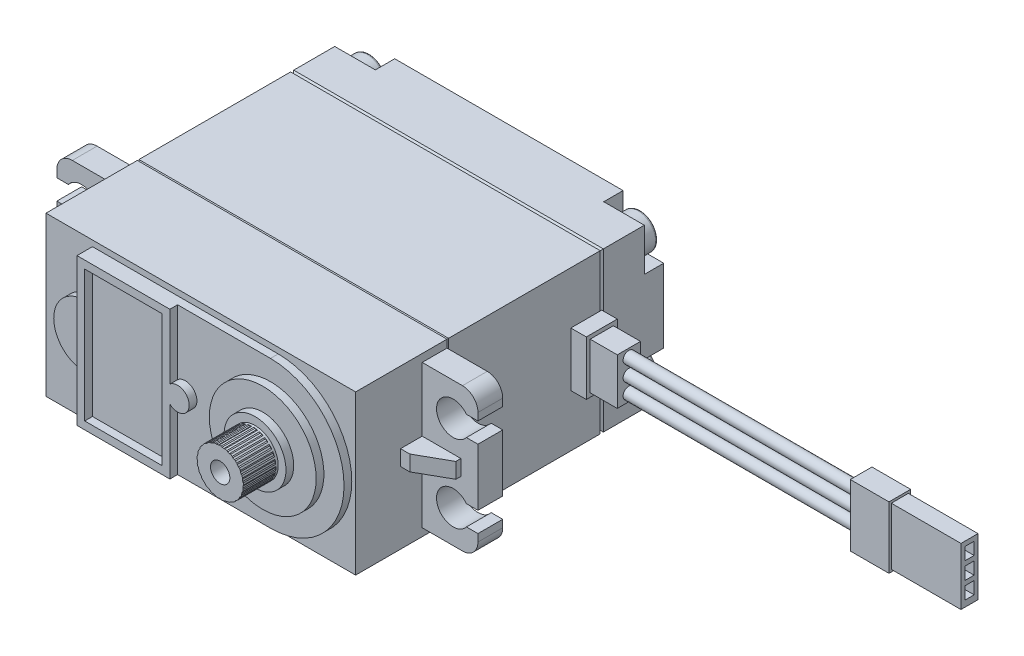
from build123d import *

# Parameters (mm, degrees)
SKETCH_1_W           = 40
SKETCH_1_H           = 20.5
EXTRUDE_1_DEPTH      = 8
CHAMFER_1_SIZE       = 0.2
SKETCH_2_W           = 40
SKETCH_2_H           = 20.5
EXTRUDE_2_DEPTH      = 20
CHAMFER_4_SIZE       = 0.2
CHAMFER_5_SIZE       = 0.2
SKETCH_3_W           = 40
SKETCH_3_H           = 20.5
EXTRUDE_3_DEPTH      = 12.8
SKETCH_4_R           = 6.9
EXTRUDE_4_DEPTH      = 2
SKETCH_5_R           = 3
EXTRUDE_5_DEPTH      = 4.5
EXTRUDE_6_DEPTH      = 3.2
SKETCH_9_W           = 5
SKETCH_9_H           = 2
EXTRUDE_7_DEPTH      = 2.8
CUT_EXTRUDE_6_DEPTH  = 2.8
SKETCH_11_R          = 1.25
CUT_EXTRUDE_7_DEPTH  = 6
CUT_EXTRUDE_START    = -4.2
CUT_EXTRUDE_8_DEPTH  = 4.2
SKETCH_13_W          = 40
SKETCH_13_H          = 20.5
CUT_EXTRUDE_9_DEPTH  = 1
FILLET_1_R           = 2
SKETCH_17_W          = 4
SKETCH_17_H          = 7
EXTRUDE_8_DEPTH      = 2
SKETCH_18_W          = 3
SKETCH_18_H          = 6
EXTRUDE_9_DEPTH      = 3.5
SKETCH_19_R          = 0.75
EXTRUDE_10_DEPTH     = 30
SKETCH_20_W          = 2.8
SKETCH_20_H          = 8
EXTRUDE_11_DEPTH     = 5
SKETCH_21_W          = 2.2
SKETCH_21_H          = 7.4
SKETCH_21_W_2        = 1.190046005
SKETCH_21_H_2        = 1.6
EXTRUDE_12_DEPTH     = 9
CUT_EXTRUDE_13_DEPTH = 2.5
SKETCH_23_R          = 2.25
EXTRUDE_13_DEPTH     = 2
FILLET_2_R           = 0.3
SKETCH_25_R          = 4
EXTRUDE_15_DEPTH     = 1
SKETCH_26_W          = 12
SKETCH_26_H          = 19
SKETCH_26_W_2        = 10
SKETCH_26_H_2        = 17
EXTRUDE_16_DEPTH     = 1
CUT_EXTRUDE_START_2  = -1
SKETCH_27_R          = 6.9
SKETCH_27_R_2        = 4
CUT_EXTRUDE_14_DEPTH = 1
SKETCH_28_R          = 1.5
EXTRUDE_17_DEPTH     = 1


with BuildPart() as part:
    # 草图1 → 凸台-拉伸1 (new body)
    with BuildSketch(Plane.XY):
        Rectangle(SKETCH_1_W, SKETCH_1_H)
    extrude(amount=EXTRUDE_1_DEPTH)

    # 倒角1
    chamfer_1_edges = [part.edges().sort_by_distance(p)[0] for p in [
        (20, 0, 8),
        (0, 10.25, 8),
        (-20, 0, 8),
        (0, -10.25, 8),
    ]]
    chamfer(chamfer_1_edges, length=CHAMFER_1_SIZE)

    # 草图2 → 凸台-拉伸2 (add)
    with BuildSketch(Plane.XY.offset(8)):
        Rectangle(SKETCH_2_W, SKETCH_2_H)
    extrude(amount=EXTRUDE_2_DEPTH)

    # 倒角4
    chamfer_4_edges = [part.edges().sort_by_distance(p)[0] for p in [
        (0, 10.25, 8),
        (-20, 0, 8),
        (0, -10.25, 8),
        (20, 0, 8),
    ]]
    chamfer(chamfer_4_edges, length=CHAMFER_4_SIZE - 0.0001)  # a hair under: the kernel refuses the full size

    # 倒角5
    chamfer_5_edges = [part.edges().sort_by_distance(p)[0] for p in [
        (0, 10.25, 28),
        (-20, 0, 28),
        (0, -10.25, 28),
        (20, 0, 28),
    ]]
    chamfer(chamfer_5_edges, length=CHAMFER_5_SIZE)

    # 草图3 → 凸台-拉伸3 (add)
    with BuildSketch(Plane.XY.offset(28)):
        Rectangle(SKETCH_3_W, SKETCH_3_H)
    extrude(amount=EXTRUDE_3_DEPTH)

    # 草图4 → 凸台-拉伸4 (add)
    with BuildSketch(Plane.XY.offset(40.8)):
        with Locations(Location((10, 0, 0), (0, 0, 180))):
            Circle(SKETCH_4_R)
    extrude(amount=EXTRUDE_4_DEPTH)

    # 草图5 → 凸台-拉伸5 (add)
    with BuildSketch(Plane.XY.offset(42.8)):
        with Locations((10, 0)):
            Circle(SKETCH_5_R)
    extrude(amount=EXTRUDE_5_DEPTH)

    # 草图8 → 凸台-拉伸6 (add)
    with BuildSketch(Plane.XY.offset(28)):
        with BuildLine():
            Line((-27.2, 9.25), (-27.2, 6.3))
            Line((-27.2, 6.3), (-25.712454379, 6.3))
            ThreePointArc((-25.712454379, 6.3), (-21.85, 5), (-25.712454379, 3.7))
            Line((-25.712454379, 3.7), (-27.2, 3.7))
            Line((-27.2, 3.7), (-27.2, -3.7))
            Line((-27.2, -3.7), (-25.712454379, -3.7))
            ThreePointArc((-25.712454379, -3.7), (-21.85, -5), (-25.712454379, -6.3))
            Line((-25.712454379, -6.3), (-27.2, -6.3))
            Line((-27.2, -6.3), (-27.2, -9.25))
            Line((-27.2, -9.25), (-20, -9.25))
            Line((-20, -9.25), (-20, 9.25))
            Line((-20, 9.25), (-27.2, 9.25))
        make_face()
        with BuildLine():
            Line((20, -9.25), (27.2, -9.25))
            Line((27.2, -9.25), (27.2, -6.3))
            Line((27.2, -6.3), (25.712454379, -6.3))
            ThreePointArc((25.712454379, -6.3), (21.85, -5), (25.712454379, -3.7))
            Line((25.712454379, -3.7), (27.2, -3.7))
            Line((27.2, -3.7), (27.2, 3.7))
            Line((27.2, 3.7), (25.712454379, 3.7))
            ThreePointArc((25.712454379, 3.7), (21.85, 5), (25.712454379, 6.3))
            Line((25.712454379, 6.3), (27.2, 6.3))
            Line((27.2, 6.3), (27.2, 9.25))
            Line((27.2, 9.25), (20, 9.25))
            Line((20, 9.25), (20, -9.25))
        make_face()
    extrude(amount=EXTRUDE_6_DEPTH)

    # 草图9 → 凸台-拉伸7 (add)
    with BuildSketch(Plane.XY.offset(31.2)):
        with Locations((-22.5, 0)):
            Rectangle(SKETCH_9_W, SKETCH_9_H)
        with Locations((22.5, 0)):
            Rectangle(SKETCH_9_W, SKETCH_9_H)
    extrude(amount=EXTRUDE_7_DEPTH)

    # 草图10 → 切除-拉伸6 (cut)
    with BuildSketch(Plane.XZ.offset(1)):
        Polygon((-25, 31.856513204), (-21.19303932, 34), (-25, 34), align=None)
        Polygon((25, 34), (25, 31.856513204), (21.19303932, 34), align=None)
    extrude(amount=-CUT_EXTRUDE_6_DEPTH, mode=Mode.SUBTRACT)

    # 草图11 → 切除-拉伸7 (cut)
    with BuildSketch(Plane.XY.offset(47.3)):
        with Locations((10, 0)):
            Circle(SKETCH_11_R)
    extrude(amount=-CUT_EXTRUDE_7_DEPTH, mode=Mode.SUBTRACT)

    # 草图12 → 切除-拉伸8 (cut)
    with BuildSketch(Plane.XY.offset(47.3).offset(CUT_EXTRUDE_START)):
        with BuildLine():
            Line((9.742545455, 2.938744146), (9.88, 2.997599039))
            ThreePointArc((9.88, 2.997599039), (9.624000299, 2.976344104), (9.370757413, 2.93326674))
            Line((9.370757413, 2.93326674), (9.518530187, 2.910444437))
            ThreePointArc((9.518530187, 2.910444437), (9.630266961, 2.926738369), (9.742545455, 2.938744146))
        make_face()
        with BuildLine():
            Line((10.257454545, 2.938744146), (10.12, 2.997599039))
            ThreePointArc((10.12, 2.997599039), (10.375999701, 2.976344104), (10.629242587, 2.93326674))
            Line((10.629242587, 2.93326674), (10.481469813, 2.910444437))
            ThreePointArc((10.481469813, 2.910444437), (10.369733039, 2.926738369), (10.257454545, 2.938744146))
        make_face()
        with BuildLine():
            Line((10.980202088, 2.782391753), (10.861702546, 2.873581167))
            ThreePointArc((10.861702546, 2.873581167), (11.104373658, 2.789329458), (11.338947549, 2.684626503))
            Line((11.338947549, 2.684626503), (11.190141652, 2.699270799))
            ThreePointArc((11.190141652, 2.699270799), (11.08596743, 2.742840633), (10.980202088, 2.782391753))
        make_face()
        with BuildLine():
            Line((11.641359928, 2.451211453), (11.549261152, 2.569005621))
            ThreePointArc((11.549261152, 2.569005621), (11.763355757, 2.427050983), (11.964521512, 2.26730131))
            Line((11.964521512, 2.26730131), (11.824032514, 2.318492051))
            ThreePointArc((11.824032514, 2.318492051), (11.733966494, 2.386600133), (11.641359928, 2.451211453))
        make_face()
        with BuildLine():
            Line((12.199385087, 1.966012523), (12.139473982, 2.103010004))
            ThreePointArc((12.139473982, 2.103010004), (12.311539728, 1.912271969), (12.466657363, 1.707513237))
            Line((12.466657363, 1.707513237), (12.343312705, 1.792033919))
            ThreePointArc((12.343312705, 1.792033919), (12.273014066, 1.88040077), (12.199385087, 1.966012523))
        make_face()
        with BuildLine():
            Line((12.619214793, 1.357281795), (12.595255794, 1.504874535))
            ThreePointArc((12.595255794, 1.504874535), (12.714481157, 1.277337875), (12.81380406, 1.040435827))
            Line((12.81380406, 1.040435827), (12.71535394, 1.152975706))
            ThreePointArc((12.71535394, 1.152975706), (12.669239805, 1.25604891), (12.619214793, 1.357281795))
        make_face()
        with BuildLine():
            Line((12.8744696, 0.66326806), (12.887968139, 0.812182263))
            ThreePointArc((12.887968139, 0.812182263), (12.946861752, 0.562143944), (12.9841491, 0.307984008))
            Line((12.9841491, 0.307984008), (12.916779501, 0.441471789))
            ThreePointArc((12.916779501, 0.441471789), (12.89774739, 0.552774878), (12.8744696, 0.66326806))
        make_face()
        with BuildLine():
            Line((12.949110911, -0.072421246), (12.999218825, 0.068457594))
            ThreePointArc((12.999218825, 0.068457594), (12.994080185, -0.188371559), (12.966989077, -0.443819578))
            Line((12.966989077, -0.443819578), (12.934933079, -0.297771424))
            ThreePointArc((12.934933079, -0.297771424), (12.944178849, -0.185232033), (12.949110911, -0.072421246))
        make_face()
        with BuildLine():
            Line((12.838448737, -0.803560059), (12.922017561, -0.679568519))
            ThreePointArc((12.922017561, -0.679568519), (12.853169549, -0.927050983), (12.763402218, -1.167736349))
            Line((12.763402218, -1.167736349), (12.768674018, -1.018304563))
            ThreePointArc((12.768674018, -1.018304563), (12.805616723, -0.911600133), (12.838448737, -0.803560059))
        make_face()
        with BuildLine():
            Line((12.54943639, -1.484208238), (12.661215188, -1.384894842))
            ThreePointArc((12.661215188, -1.384894842), (12.532983777, -1.607480385), (12.386180635, -1.81827995))
            Line((12.386180635, -1.81827995), (12.428448985, -1.674853882))
            ThreePointArc((12.428448985, -1.674853882), (12.49076738, -1.580689045), (12.54943639, -1.484208238))
        make_face()
        with BuildLine():
            Line((12.100233578, -2.071598155), (12.233198877, -2.003203128))
            ThreePointArc((12.233198877, -2.003203128), (12.053641318, -2.186905882), (11.859026547, -2.354574335))
            Line((11.859026547, -2.354574335), (11.935635572, -2.226165971))
            ThreePointArc((11.935635572, -2.226165971), (12.019413962, -2.150457451), (12.100233578, -2.071598155))
        make_face()
        with BuildLine():
            Line((11.519065367, -2.528821941), (11.664862468, -2.495642795))
            ThreePointArc((11.664862468, -2.495642795), (11.445261022, -2.62892004), (11.215062984, -2.742922154))
            Line((11.215062984, -2.742922154), (11.321199057, -2.637599866))
            ThreePointArc((11.321199057, -2.637599866), (11.421173339, -2.585104706), (11.519065367, -2.528821941))
        make_face()
        with BuildLine():
            Line((10.842448692, -2.827150545), (10.991916627, -2.831272047))
            ThreePointArc((10.991916627, -2.831272047), (10.746069661, -2.905749483), (10.494752545, -2.958922087))
            Line((10.494752545, -2.958922087), (10.623746746, -2.88330366))
            ThreePointArc((10.623746746, -2.88330366), (10.733635167, -2.857320325), (10.842448692, -2.827150545))
        make_face()
        with BuildLine():
            Line((10.112897867, -2.947838882), (10.256645016, -2.989002063))
            ThreePointArc((10.256645016, -2.989002063), (10, -3), (9.743354984, -2.989002063))
            Line((9.743354984, -2.989002063), (9.887102133, -2.947838882))
            ThreePointArc((9.887102133, -2.947838882), (10, -2.95), (10.112897867, -2.947838882))
        make_face()
        with BuildLine():
            Line((9.376253254, -2.88330366), (9.505247455, -2.958922087))
            ThreePointArc((9.505247455, -2.958922087), (9.253930339, -2.905749483), (9.008083373, -2.831272047))
            Line((9.008083373, -2.831272047), (9.157551308, -2.827150545))
            ThreePointArc((9.157551308, -2.827150545), (9.266364833, -2.857320325), (9.376253254, -2.88330366))
        make_face()
        with BuildLine():
            Line((8.678800943, -2.637599866), (8.784937016, -2.742922154))
            ThreePointArc((8.784937016, -2.742922154), (8.554738978, -2.62892004), (8.335137532, -2.495642795))
            Line((8.335137532, -2.495642795), (8.480934633, -2.528821941))
            ThreePointArc((8.480934633, -2.528821941), (8.578826661, -2.585104706), (8.678800943, -2.637599866))
        make_face()
        with BuildLine():
            Line((8.064364428, -2.226165971), (8.140973453, -2.354574335))
            ThreePointArc((8.140973453, -2.354574335), (7.946358682, -2.186905882), (7.766801123, -2.003203128))
            Line((7.766801123, -2.003203128), (7.899766422, -2.071598155))
            ThreePointArc((7.899766422, -2.071598155), (7.980586038, -2.150457451), (8.064364428, -2.226165971))
        make_face()
        with BuildLine():
            Line((7.571551015, -1.674853882), (7.613819365, -1.81827995))
            ThreePointArc((7.613819365, -1.81827995), (7.467016223, -1.607480385), (7.338784812, -1.384894842))
            Line((7.338784812, -1.384894842), (7.45056361, -1.484208238))
            ThreePointArc((7.45056361, -1.484208238), (7.50923262, -1.580689045), (7.571551015, -1.674853882))
        make_face()
        with BuildLine():
            Line((7.231325982, -1.018304563), (7.236597782, -1.167736349))
            ThreePointArc((7.236597782, -1.167736349), (7.146830451, -0.927050983), (7.077982439, -0.679568519))
            Line((7.077982439, -0.679568519), (7.161551263, -0.803560059))
            ThreePointArc((7.161551263, -0.803560059), (7.194383277, -0.911600133), (7.231325982, -1.018304563))
        make_face()
        with BuildLine():
            Line((7.065066921, -0.297771424), (7.033010923, -0.443819578))
            ThreePointArc((7.033010923, -0.443819578), (7.005919815, -0.188371559), (7.000781175, 0.068457594))
            Line((7.000781175, 0.068457594), (7.050889089, -0.072421246))
            ThreePointArc((7.050889089, -0.072421246), (7.055821151, -0.185232033), (7.065066921, -0.297771424))
        make_face()
        with BuildLine():
            Line((7.083220499, 0.441471789), (7.0158509, 0.307984008))
            ThreePointArc((7.0158509, 0.307984008), (7.053138248, 0.562143944), (7.112031861, 0.812182263))
            Line((7.112031861, 0.812182263), (7.1255304, 0.66326806))
            ThreePointArc((7.1255304, 0.66326806), (7.10225261, 0.552774878), (7.083220499, 0.441471789))
        make_face()
        with BuildLine():
            Line((7.28464606, 1.152975706), (7.18619594, 1.040435827))
            ThreePointArc((7.18619594, 1.040435827), (7.285518843, 1.277337875), (7.404744206, 1.504874535))
            Line((7.404744206, 1.504874535), (7.380785207, 1.357281795))
            ThreePointArc((7.380785207, 1.357281795), (7.330760195, 1.25604891), (7.28464606, 1.152975706))
        make_face()
        with BuildLine():
            Line((7.656687295, 1.792033919), (7.533342637, 1.707513237))
            ThreePointArc((7.533342637, 1.707513237), (7.688460272, 1.912271969), (7.860526018, 2.103010004))
            Line((7.860526018, 2.103010004), (7.800614913, 1.966012523))
            ThreePointArc((7.800614913, 1.966012523), (7.726985934, 1.88040077), (7.656687295, 1.792033919))
        make_face()
        with BuildLine():
            Line((8.175967486, 2.318492051), (8.035478488, 2.26730131))
            ThreePointArc((8.035478488, 2.26730131), (8.236644243, 2.427050983), (8.450738848, 2.569005621))
            Line((8.450738848, 2.569005621), (8.358640072, 2.451211453))
            ThreePointArc((8.358640072, 2.451211453), (8.266033506, 2.386600133), (8.175967486, 2.318492051))
        make_face()
        with BuildLine():
            Line((8.809858348, 2.699270799), (8.661052451, 2.684626503))
            ThreePointArc((8.661052451, 2.684626503), (8.895626342, 2.789329458), (9.138297454, 2.873581167))
            Line((9.138297454, 2.873581167), (9.019797912, 2.782391753))
            ThreePointArc((9.019797912, 2.782391753), (8.91403257, 2.742840633), (8.809858348, 2.699270799))
        make_face()
    extrude(amount=CUT_EXTRUDE_8_DEPTH, mode=Mode.SUBTRACT)

    # 草图13 → 切除-拉伸9 (cut)
    with BuildSketch(Plane.XY.offset(40.8)):
        Rectangle(SKETCH_13_W, SKETCH_13_H)
        with BuildLine():
            Line((10, 9.5), (-14, 9.5))
            Line((-14, 9.5), (-14, -9.5))
            Line((-14, -9.5), (10, -9.5))
            ThreePointArc((10, -9.5), (19.5, 0), (10, 9.5))
        make_face(mode=Mode.SUBTRACT)
    extrude(amount=-CUT_EXTRUDE_9_DEPTH, mode=Mode.SUBTRACT)

    # 圆角1
    fillet_1_edges = [part.edges().sort_by_distance(p)[0] for p in [
        (-27.2, 9.25, 29.6),
        (-27.2, -9.25, 29.6),
        (27.2, -9.25, 29.6),
        (27.2, 9.25, 29.6),
    ]]
    fillet(fillet_1_edges, radius=FILLET_1_R)

    # 草图17 → 凸台-拉伸8 (add)
    with BuildSketch(Plane(origin=(20, 0, 0), x_dir=(0, 0, -1), z_dir=(1, 0, 0))):
        with Locations((-10, 0)):
            Rectangle(SKETCH_17_W, SKETCH_17_H)
    extrude(amount=EXTRUDE_8_DEPTH)

    # 草图18 → 凸台-拉伸9 (add)
    with BuildSketch(Plane(origin=(22, 0, 0), x_dir=(0, 0, -1), z_dir=(1, 0, 0))):
        with Locations((-10, 0)):
            Rectangle(SKETCH_18_W, SKETCH_18_H)
    extrude(amount=EXTRUDE_9_DEPTH)

    # 草图19 → 凸台-拉伸10 (add)
    with BuildSketch(Plane(origin=(25.5, 0, 0), x_dir=(0, 0, -1), z_dir=(1, 0, 0))):
        with Locations((-10, 0)):
            Circle(SKETCH_19_R)
        with Locations((-10, 2)):
            Circle(SKETCH_19_R)
        with Locations((-10, -2)):
            Circle(SKETCH_19_R)
    extrude(amount=EXTRUDE_10_DEPTH)

    # 草图20 → 凸台-拉伸11 (add)
    with BuildSketch(Plane(origin=(55.5, 0, 0), x_dir=(0, 0, -1), z_dir=(1, 0, 0))):
        with Locations((-10, 0)):
            Rectangle(SKETCH_20_W, SKETCH_20_H)
    extrude(amount=EXTRUDE_11_DEPTH)

    # 草图21 → 凸台-拉伸12 (add)
    with BuildSketch(Plane(origin=(60.5, 0, 0), x_dir=(0, 0, -1), z_dir=(1, 0, 0))):
        with Locations((-10, 0)):
            Rectangle(SKETCH_21_W, SKETCH_21_H)
        with Locations((-9.995023003, 2.3)):
            Rectangle(SKETCH_21_W_2, SKETCH_21_H_2, mode=Mode.SUBTRACT)
        with Locations((-9.995023003, 0.1)):
            Rectangle(SKETCH_21_W_2, SKETCH_21_H_2, mode=Mode.SUBTRACT)
        with Locations((-9.995023003, -2.1)):
            Rectangle(SKETCH_21_W_2, SKETCH_21_H_2, mode=Mode.SUBTRACT)
    extrude(amount=EXTRUDE_12_DEPTH)

    # 草图22 → 切除-拉伸13 (cut)
    with BuildSketch(Plane(origin=(0, 0, 0), x_dir=(-1, 0, 0), z_dir=(0, 0, -1))):
        with BuildLine():
            Line((-20, 4.75), (-20, 10.25))
            Line((-20, 10.25), (-14.75, 10.25))
            Line((-14.75, 10.25), (-14.75, 7.5))
            ThreePointArc((-14.75, 7.5), (-15.555456352, 5.555456352), (-17.5, 4.75))
            Line((-17.5, 4.75), (-20, 4.75))
        make_face()
        with BuildLine():
            Line((-17.5, -4.75), (-20, -4.75))
            Line((-20, -4.75), (-20, -10.25))
            Line((-20, -10.25), (-14.75, -10.25))
            Line((-14.75, -10.25), (-14.75, -7.5))
            ThreePointArc((-14.75, -7.5), (-15.555456352, -5.555456352), (-17.5, -4.75))
        make_face()
        with BuildLine():
            Line((14.75, -7.5), (14.75, -10.25))
            Line((14.75, -10.25), (20, -10.25))
            Line((20, -10.25), (20, -4.75))
            Line((20, -4.75), (17.5, -4.75))
            ThreePointArc((17.5, -4.75), (15.555456352, -5.555456352), (14.75, -7.5))
        make_face()
        with BuildLine():
            Line((20, 4.75), (20, 10.25))
            Line((20, 10.25), (14.75, 10.25))
            Line((14.75, 10.25), (14.75, 7.5))
            ThreePointArc((14.75, 7.5), (15.555456352, 5.555456352), (17.5, 4.75))
            Line((17.5, 4.75), (20, 4.75))
        make_face()
    extrude(amount=-CUT_EXTRUDE_13_DEPTH, mode=Mode.SUBTRACT)

    # 草图23 → 凸台-拉伸13 (add)
    # profile 1 of 4: a face of its own
    with BuildSketch(Plane(origin=(0, 0, 2.5), x_dir=(-1, 0, 0), z_dir=(0, 0, -1))):
        with Locations(Location((-17.5, 7.5, 0), (0, 0, 180))):
            Circle(SKETCH_23_R)
        with BuildLine():
            Line((-17.25, 7.25), (-17.25, 5.61651918))
            ThreePointArc((-17.25, 5.61651918), (-17.5, 5.6), (-17.75, 5.61651918))
            Line((-17.75, 5.61651918), (-17.75, 7.25))
            Line((-17.75, 7.25), (-19.38348082, 7.25))
            ThreePointArc((-19.38348082, 7.25), (-19.4, 7.5), (-19.38348082, 7.75))
            Line((-19.38348082, 7.75), (-17.75, 7.75))
            Line((-17.75, 7.75), (-17.75, 9.38348082))
            ThreePointArc((-17.75, 9.38348082), (-17.5, 9.4), (-17.25, 9.38348082))
            Line((-17.25, 9.38348082), (-17.25, 7.75))
            Line((-17.25, 7.75), (-15.61651918, 7.75))
            ThreePointArc((-15.61651918, 7.75), (-15.6, 7.5), (-15.61651918, 7.25))
            Line((-15.61651918, 7.25), (-17.25, 7.25))
        make_face(mode=Mode.SUBTRACT)
    # profile 2 of 4: a face of its own
    with BuildSketch(Plane(origin=(0, 0, 2.5), x_dir=(-1, 0, 0), z_dir=(0, 0, -1))):
        with Locations(Location((-17.5, -7.5, 0), (0, 0, 180))):
            Circle(SKETCH_23_R)
        with BuildLine():
            Line((-17.25, -7.75), (-15.61651918, -7.75))
            ThreePointArc((-15.61651918, -7.75), (-15.6, -7.5), (-15.61651918, -7.25))
            Line((-15.61651918, -7.25), (-17.25, -7.25))
            Line((-17.25, -7.25), (-17.25, -5.61651918))
            ThreePointArc((-17.25, -5.61651918), (-17.5, -5.6), (-17.75, -5.61651918))
            Line((-17.75, -5.61651918), (-17.75, -7.25))
            Line((-17.75, -7.25), (-19.38348082, -7.25))
            ThreePointArc((-19.38348082, -7.25), (-19.4, -7.5), (-19.38348082, -7.75))
            Line((-19.38348082, -7.75), (-17.75, -7.75))
            Line((-17.75, -7.75), (-17.75, -9.38348082))
            ThreePointArc((-17.75, -9.38348082), (-17.5, -9.4), (-17.25, -9.38348082))
            Line((-17.25, -9.38348082), (-17.25, -7.75))
        make_face(mode=Mode.SUBTRACT)
    # profile 3 of 4: a face of its own
    with BuildSketch(Plane(origin=(0, 0, 2.5), x_dir=(-1, 0, 0), z_dir=(0, 0, -1))):
        with Locations(Location((17.5, -7.5, 0), (0, 0, 180))):
            Circle(SKETCH_23_R)
        with BuildLine():
            Line((17.25, -7.25), (15.61651918, -7.25))
            ThreePointArc((15.61651918, -7.25), (15.6, -7.5), (15.61651918, -7.75))
            Line((15.61651918, -7.75), (17.25, -7.75))
            Line((17.25, -7.75), (17.25, -9.38348082))
            ThreePointArc((17.25, -9.38348082), (17.5, -9.4), (17.75, -9.38348082))
            Line((17.75, -9.38348082), (17.75, -7.75))
            Line((17.75, -7.75), (19.38348082, -7.75))
            ThreePointArc((19.38348082, -7.75), (19.4, -7.5), (19.38348082, -7.25))
            Line((19.38348082, -7.25), (17.75, -7.25))
            Line((17.75, -7.25), (17.75, -5.61651918))
            ThreePointArc((17.75, -5.61651918), (17.5, -5.6), (17.25, -5.61651918))
            Line((17.25, -5.61651918), (17.25, -7.25))
        make_face(mode=Mode.SUBTRACT)
    # profile 4 of 4: a face of its own
    with BuildSketch(Plane(origin=(0, 0, 2.5), x_dir=(-1, 0, 0), z_dir=(0, 0, -1))):
        with Locations(Location((17.5, 7.5, 0), (0, 0, 180))):
            Circle(SKETCH_23_R)
        with BuildLine():
            Line((19.38348082, 7.25), (17.75, 7.25))
            Line((17.75, 7.25), (17.75, 5.61651918))
            ThreePointArc((17.75, 5.61651918), (17.5, 5.6), (17.25, 5.61651918))
            Line((17.25, 5.61651918), (17.25, 7.25))
            Line((17.25, 7.25), (15.61651918, 7.25))
            ThreePointArc((15.61651918, 7.25), (15.6, 7.5), (15.61651918, 7.75))
            Line((15.61651918, 7.75), (17.25, 7.75))
            Line((17.25, 7.75), (17.25, 9.38348082))
            ThreePointArc((17.25, 9.38348082), (17.5, 9.4), (17.75, 9.38348082))
            Line((17.75, 9.38348082), (17.75, 7.75))
            Line((17.75, 7.75), (19.38348082, 7.75))
            ThreePointArc((19.38348082, 7.75), (19.4, 7.5), (19.38348082, 7.25))
        make_face(mode=Mode.SUBTRACT)
    extrude(amount=EXTRUDE_13_DEPTH)

    # 圆角2
    fillet_2_edges = [part.edges().sort_by_distance(p)[0] for p in [
        (15.25, 7.5, 0.5),
        (15.25, -7.5, 0.5),
        (-19.75, -7.5, 0.5),
        (-19.75, 7.5, 0.5),
    ]]
    fillet(fillet_2_edges, radius=FILLET_2_R)

    # 草图25 → 凸台-拉伸15 (add)
    with BuildSketch(Plane.XY.offset(40.8)):
        with Locations((-14, 0)):
            Circle(SKETCH_25_R)
    extrude(amount=-EXTRUDE_15_DEPTH)

    # 草图26 → 凸台-拉伸16 (add)
    with BuildSketch(Plane.XY.offset(40.8)):
        with Locations((-8, 0)):
            Rectangle(SKETCH_26_W, SKETCH_26_H)
        with Locations((-8, 0)):
            Rectangle(SKETCH_26_W_2, SKETCH_26_H_2, mode=Mode.SUBTRACT)
    extrude(amount=EXTRUDE_16_DEPTH)

    # 草图27 → 切除-拉伸14 (cut)
    with BuildSketch(Plane.XY.offset(42.8).offset(CUT_EXTRUDE_START_2)):
        with Locations(Location((10, 0, 0), (0, 0, 180))):
            Circle(SKETCH_27_R)
        with Locations((10, 0)):
            Circle(SKETCH_27_R_2, mode=Mode.SUBTRACT)
    extrude(amount=CUT_EXTRUDE_14_DEPTH, mode=Mode.SUBTRACT)

    # 草图28 → 凸台-拉伸17 (add)
    with BuildSketch(Plane.XY.offset(40.8)):
        with Locations((-1, 0)):
            Circle(SKETCH_28_R)
    extrude(amount=EXTRUDE_17_DEPTH)


solid = part.part
